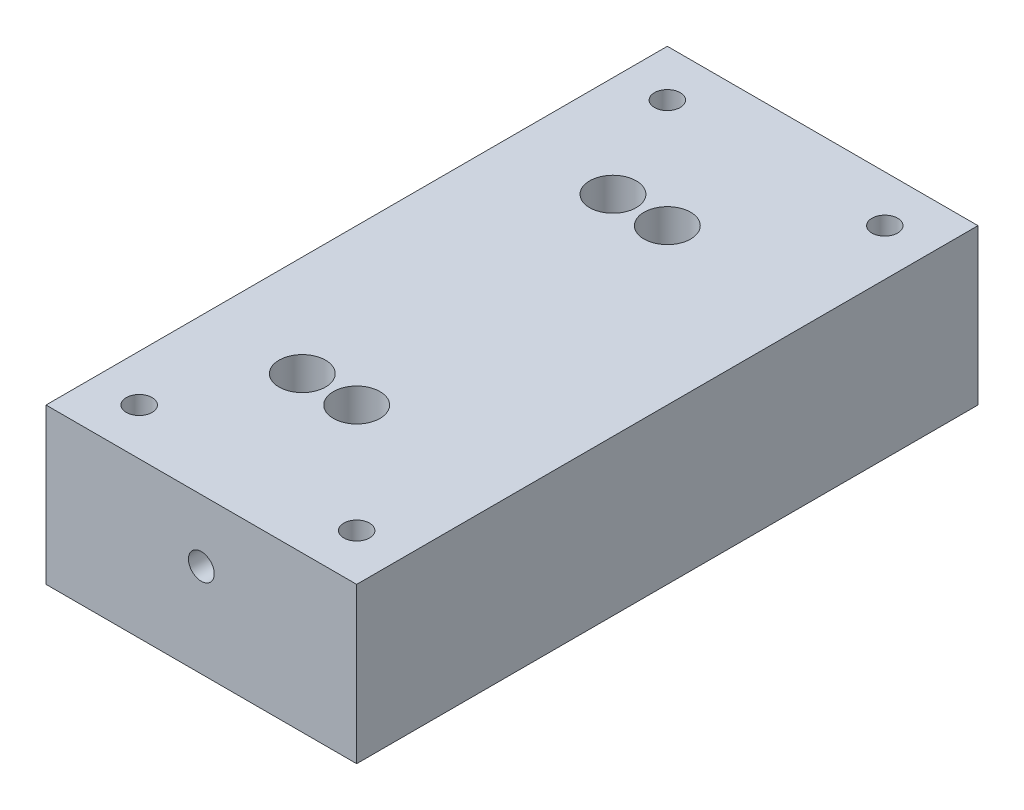
from build123d import *

# Parameters (mm, degrees)
SKIZZE1_W                                           = 100
SKIZZE1_H                                           = 50
AUFSATZ_LINEAR_AUSTRAGEN1_DEPTH                     = 200
STIRNSENKUNG_F_R_M8_SENKSCHRAUBE_KOPF_B_D           = 9
STIRNSENKUNG_F_R_M8_SENKSCHRAUBE_KOPF_B_CBORE_D     = 15
STIRNSENKUNG_F_R_M8_SENKSCHRAUBE_KOPF_B_CBORE_DEPTH = 34.5
STIRNSENKUNG_F_R_M8_SENKSCHRAUBE_KO_2_D             = 9
STIRNSENKUNG_F_R_M8_SENKSCHRAUBE_KO_2_DEPTH         = 50
STIRNSENKUNG_F_R_M8_SENKSCHRAUBE_KO_2_CBORE_D       = 15
STIRNSENKUNG_F_R_M8_SENKSCHRAUBE_KO_2_CBORE_DEPTH   = 6.5
SPIEGELN4_COPY_1_D                                  = 9
SPIEGELN4_COPY_1_CBORE_D                            = 15
SPIEGELN4_COPY_1_CBORE_DEPTH                        = 34.5
SPIEGELN4_COPY_2_D                                  = 9
SPIEGELN4_COPY_2_DEPTH                              = 50
SPIEGELN4_COPY_2_CBORE_D                            = 15
SPIEGELN4_COPY_2_CBORE_DEPTH                        = 6.5
KERNLOCH_F_R_M8_HELICOIL3_D                         = 8.3
KERNLOCH_F_R_M8_HELICOIL3_DEPTH                     = 20
KERNLOCH_F_R_M8_HELICOIL3_TIP                       = 2.493571569
KERNLOCH_F_R_M8_HELICOIL4_D                         = 8.3
KERNLOCH_F_R_M8_HELICOIL4_DEPTH                     = 20
KERNLOCH_F_R_M8_HELICOIL4_TIP                       = 2.493571569


# Read off the part's stored shape, not the designer's step: Kernloch für M8 Helicoil2
with BuildPart() as part:
    # Skizze1 → Aufsatz-Linear austragen1 (new body)
    with BuildSketch(Plane.XY):
        Rectangle(SKIZZE1_W, SKIZZE1_H)
    extrude(amount=AUFSATZ_LINEAR_AUSTRAGEN1_DEPTH)

    # Stirnsenkung f_r M8 Senkschraube _Kopf B (through all)
    with Locations(Plane(origin=(0, 25, 0), x_dir=(1, 0, 0), z_dir=(0, 1, 0))):
        with Locations((0, -150)):
            stirnsenkung_f_r_m8_senkschraube_kopf_b = CounterBoreHole(STIRNSENKUNG_F_R_M8_SENKSCHRAUBE_KOPF_B_D / 2, STIRNSENKUNG_F_R_M8_SENKSCHRAUBE_KOPF_B_CBORE_D / 2, STIRNSENKUNG_F_R_M8_SENKSCHRAUBE_KOPF_B_CBORE_DEPTH)

    # Stirnsenkung f_r M8 Senkschraube _Ko 2
    with Locations(Plane(origin=(0, -25, 0), x_dir=(-1, 0, 0), z_dir=(0, -1, 0))):
        with Locations((0, -150)):
            stirnsenkung_f_r_m8_senkschraube_ko_2 = CounterBoreHole(STIRNSENKUNG_F_R_M8_SENKSCHRAUBE_KO_2_D / 2, STIRNSENKUNG_F_R_M8_SENKSCHRAUBE_KO_2_CBORE_D / 2, STIRNSENKUNG_F_R_M8_SENKSCHRAUBE_KO_2_CBORE_DEPTH, depth=STIRNSENKUNG_F_R_M8_SENKSCHRAUBE_KO_2_DEPTH)

    # Spiegeln1: Stirnsenkung f_r M8 Senkschraube _Kopf B, Stirnsenkung f_r M8 Senkschraube _Ko 2 across plane
    add(stirnsenkung_f_r_m8_senkschraube_kopf_b.mirror(Plane.XY.offset(100)), mode=Mode.SUBTRACT)
    add(stirnsenkung_f_r_m8_senkschraube_ko_2.mirror(Plane.XY.offset(100)), mode=Mode.SUBTRACT)

    # Skizze10 → Kernloch für M8 Helicoil1 (revolve, cut)
    with BuildSketch(Plane(origin=(-35, 25, 185), x_dir=(0, 0, 1), z_dir=(1, 0, 0))):
        Polygon((0, 0), (0, 32.493571569), (4.15, 30), (4.15, 0), align=None)
    kernloch_f_r_m8_helicoil1 = revolve(axis=Axis((-35, 31.35, 185), (0, -1, 0)), mode=Mode.SUBTRACT)

    # Spiegeln2: Kernloch für M8 Helicoil1 across plane
    add(kernloch_f_r_m8_helicoil1.mirror(Plane(origin=(0, 0, 0), x_dir=(0, 0, 1), z_dir=(1, 0, 0))), mode=Mode.SUBTRACT)

    # Spiegeln3: Kernloch für M8 Helicoil1 across plane
    add(kernloch_f_r_m8_helicoil1.mirror(Plane.XY.offset(100)), mode=Mode.SUBTRACT)

    # Spiegeln3 copy 1 sketch → Spiegeln3 copy 1 (revolve, cut)
    with BuildSketch(Plane(origin=(35, 25, 15), x_dir=(0, 0, -1), z_dir=(-1, 0, 0))):
        Polygon((0, 0), (0, 32.493571569), (4.15, 30), (4.15, 0), align=None)
    revolve(axis=Axis((35, 31.35, 15), (0, -1, 0)), mode=Mode.SUBTRACT)

    # Kernloch für M8 Helicoil2 outline → Kernloch für M8 Helicoil2 (revolve, cut)
    with BuildSketch(Plane(origin=(0, 7.5, 35), x_dir=(0, 1, 0), z_dir=(0, 0, -1))):
        Polygon((4.15, -20), (0, -17.506428431), (0, -50), (4.15, -50), align=None)
    revolve(axis=Axis((0, 7.5, 35), (1, 0, 0)), mode=Mode.SUBTRACT)

    # Kernloch f_r M8 Helicoil2 2 outline → Kernloch f_r M8 Helicoil2 2 (revolve, cut)
    with BuildSketch(Plane(origin=(0, 7.5, 165), x_dir=(0, 1, 0), z_dir=(0, 0, -1))):
        Polygon((4.15, -20), (0, -17.506428431), (0, -50), (4.15, -50), align=None)
    revolve(axis=Axis((0, 7.5, 165), (1, 0, 0)), mode=Mode.SUBTRACT)

    # Spiegeln4: Stirnsenkung f_r M8 Senkschraube _Kopf B, Stirnsenkung f_r M8 Senkschraube _Ko 2 across plane
    add(stirnsenkung_f_r_m8_senkschraube_kopf_b.mirror(Plane(origin=(-8.75, 0, 0), x_dir=(0, 0, 1), z_dir=(1, 0, 0))), mode=Mode.SUBTRACT)
    add(stirnsenkung_f_r_m8_senkschraube_ko_2.mirror(Plane(origin=(-8.75, 0, 0), x_dir=(0, 0, 1), z_dir=(1, 0, 0))), mode=Mode.SUBTRACT)

    # Spiegeln4 copy 1 (through all)
    with Locations(Plane(origin=(-17.5, 25, 200), x_dir=(-1, 0, 0), z_dir=(0, 1, 0))):
        with Locations((0, -150)):
            CounterBoreHole(SPIEGELN4_COPY_1_D / 2, SPIEGELN4_COPY_1_CBORE_D / 2, SPIEGELN4_COPY_1_CBORE_DEPTH)

    # Spiegeln4 copy 2
    with Locations(Plane(origin=(-17.5, -25, 200), x_dir=(1, 0, 0), z_dir=(0, -1, 0))):
        with Locations((0, -150)):
            CounterBoreHole(SPIEGELN4_COPY_2_D / 2, SPIEGELN4_COPY_2_CBORE_D / 2, SPIEGELN4_COPY_2_CBORE_DEPTH, depth=SPIEGELN4_COPY_2_DEPTH)

    # Kernloch für M8 Helicoil3
    with Locations(Plane.XY.offset(200)):
        with Locations((4.444e-06, 5)):
            Hole(KERNLOCH_F_R_M8_HELICOIL3_D / 2, depth=KERNLOCH_F_R_M8_HELICOIL3_DEPTH)
            with Locations((0, 0, -(KERNLOCH_F_R_M8_HELICOIL3_DEPTH + KERNLOCH_F_R_M8_HELICOIL3_TIP / 2))):  # 118° drill point
                Cone(0, KERNLOCH_F_R_M8_HELICOIL3_D / 2, KERNLOCH_F_R_M8_HELICOIL3_TIP, mode=Mode.SUBTRACT)

    # Kernloch für M8 Helicoil4
    with Locations(Plane(origin=(0, 0, 0), x_dir=(-1, 0, 0), z_dir=(0, 0, -1))):
        with Locations((17.534722222, -5)):
            Hole(KERNLOCH_F_R_M8_HELICOIL4_D / 2, depth=KERNLOCH_F_R_M8_HELICOIL4_DEPTH)
            with Locations((0, 0, -(KERNLOCH_F_R_M8_HELICOIL4_DEPTH + KERNLOCH_F_R_M8_HELICOIL4_TIP / 2))):  # 118° drill point
                Cone(0, KERNLOCH_F_R_M8_HELICOIL4_D / 2, KERNLOCH_F_R_M8_HELICOIL4_TIP, mode=Mode.SUBTRACT)


solid = part.part
